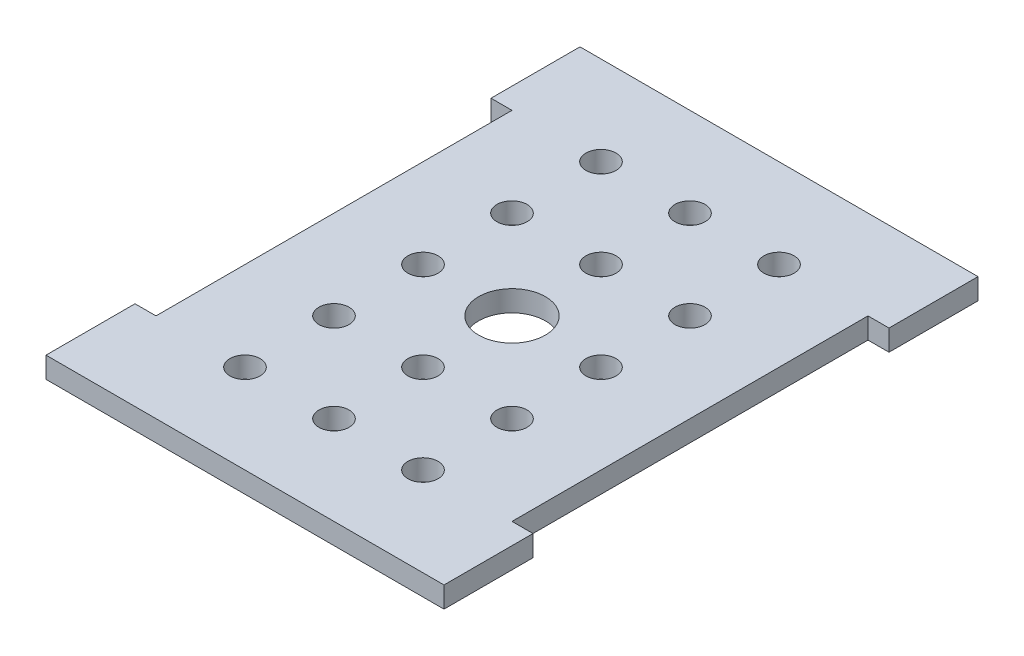
from build123d import *

# Parameters (mm, degrees)
SKETCH1_W                 = 50.8
SKETCH1_H                 = 76.2
BOSS_EXTRUDE1_DEPTH       = 2.9972
SKETCH2_W                 = 2.9972
SKETCH2_H                 = 12.7
BOSS_EXTRUDE2_DEPTH       = 2.9972
F_8_CLEARANCE_HOLE1_D     = 4.3053
F_8_CLEARANCE_HOLE1_DEPTH = 6.351016
SKETCH6_R                 = 4.7625
CUT_EXTRUDE1_DEPTH        = 48.612962265


with BuildPart() as part:
    # Sketch1 → Boss-Extrude1 (new body)
    with BuildSketch(Plane(origin=(0, 0, 0), x_dir=(1, 0, 0), z_dir=(0, 1, 0))):
        Rectangle(SKETCH1_W, SKETCH1_H)
    extrude(amount=BOSS_EXTRUDE1_DEPTH)

    # Sketch2 → Boss-Extrude2 (add)
    with BuildSketch(Plane(origin=(0, 2.9972, 0), x_dir=(1, 0, 0), z_dir=(0, 1, 0))):
        with Locations((26.8986, 31.75)):
            Rectangle(SKETCH2_W, SKETCH2_H)
        with Locations((26.8986, -31.75)):
            Rectangle(SKETCH2_W, SKETCH2_H)
        with Locations((-26.8986, -31.75)):
            Rectangle(SKETCH2_W, SKETCH2_H)
        with Locations((-26.8986, 31.75)):
            Rectangle(SKETCH2_W, SKETCH2_H)
    extrude(amount=-BOSS_EXTRUDE2_DEPTH)

    # #8 Clearance Hole1
    with Locations(Plane(origin=(0, 2.9972, 0), x_dir=(1, 0, 0), z_dir=(0, 1, 0))):
        with Locations((12.7, -25.4), (0, -25.4), (-12.7, -25.4), (-12.7, -12.7), (0, -12.7), (12.7, -12.7), (-12.7, 0), (0, 0), (12.7, 0), (12.7, 12.7), (0, 12.7), (-12.7, 12.7), (-12.7, 25.4), (0, 25.4), (12.7, 25.4)):
            Hole(F_8_CLEARANCE_HOLE1_D / 2, depth=F_8_CLEARANCE_HOLE1_DEPTH)

    # Sketch6 → Cut-Extrude1 (cut, through all)
    with BuildSketch(Plane(origin=(0, 2.9972, 0), x_dir=(1, 0, 0), z_dir=(0, 1, 0))):
        Circle(SKETCH6_R)
    extrude(amount=-CUT_EXTRUDE1_DEPTH, mode=Mode.SUBTRACT)


solid = part.part
